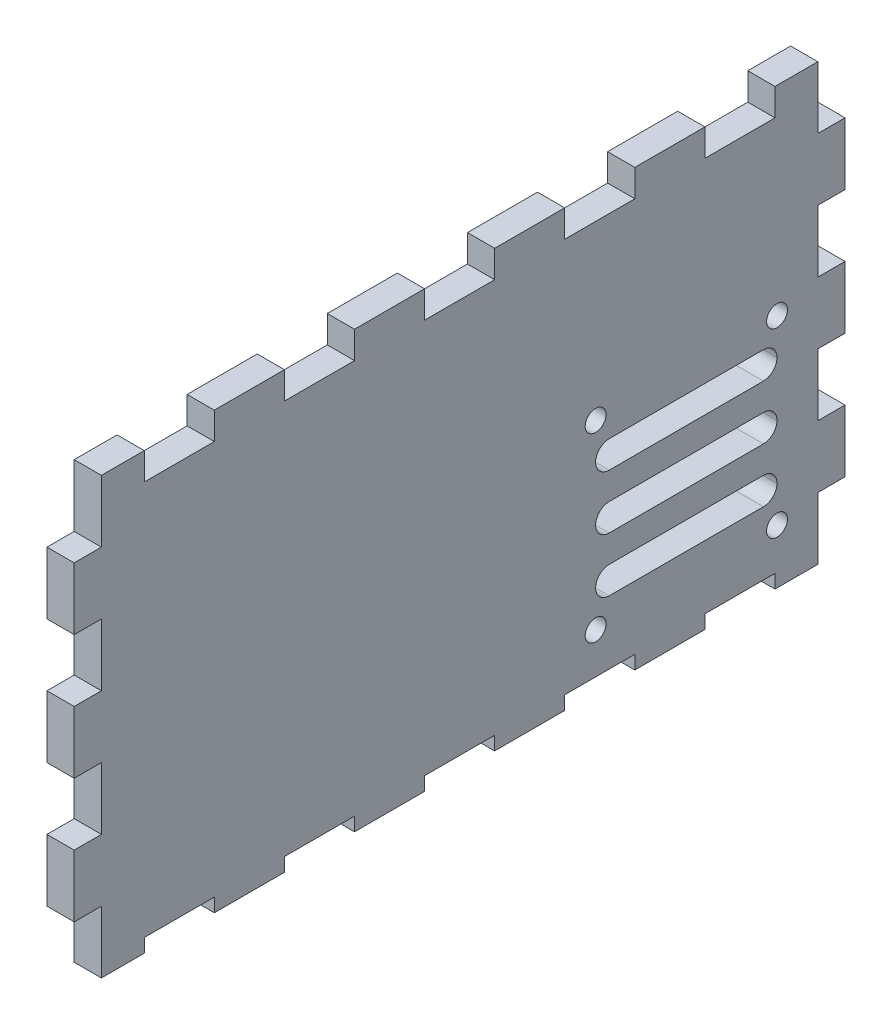
from build123d import *

# Parameters (mm, degrees)
ESBO_O1_W                = 170
ESBO_O1_H                = 96
RESSALTO_EXTRUS_O1_DEPTH = 6
CORTE_EXTRUS_O1_REACH    = 99.801
ESBO_O2_W                = 15.455454545
ESBO_O2_H                = 6
CORTE_EXTRUS_O2_REACH    = 99.801
ESBO_O3_W                = 6
ESBO_O3_H                = 13.714285714
CORTE_EXTRUS_O3_REACH    = 99.801
ESBO_O4_W                = 40
ESBO_O4_H                = 6
ESBO_O4_R                = 2.3
FILETE1_R                = 3


with BuildPart() as part:
    # Esboço1 → Ressalto-extrusão1 (new body)
    with BuildSketch(Plane(origin=(0, 0, 0), x_dir=(0, 0, -1), z_dir=(1, 0, 0))):
        Rectangle(ESBO_O1_W, ESBO_O1_H)
    extrude(amount=RESSALTO_EXTRUS_O1_DEPTH)

    # Esboço2 → Corte-extrusão1 (cut, up to next)
    with BuildSketch(Plane(origin=(6, 0, 0), x_dir=(0, 0, -1), z_dir=(1, 0, 0)), mode=Mode.PRIVATE) as corte_extrus_o1_sk1:
        with Locations((0.002272727, 45)):
            Rectangle(ESBO_O2_W, ESBO_O2_H)
    corte_extrus_o1_tool1 = extrude(corte_extrus_o1_sk1.sketch, amount=-CORTE_EXTRUS_O1_REACH, mode=Mode.PRIVATE) & part.part
    # Esboço2 → Corte-extrusão1 (cut, up to next)
    with BuildSketch(Plane(origin=(6, 0, 0), x_dir=(0, 0, -1), z_dir=(1, 0, 0)), mode=Mode.PRIVATE) as corte_extrus_o1_sk2:
        with Locations((-30.907727273, 45)):
            Rectangle(ESBO_O2_W, ESBO_O2_H)
    corte_extrus_o1_tool2 = extrude(corte_extrus_o1_sk2.sketch, amount=-CORTE_EXTRUS_O1_REACH, mode=Mode.PRIVATE) & part.part
    # Esboço2 → Corte-extrusão1 (cut, up to next)
    with BuildSketch(Plane(origin=(6, 0, 0), x_dir=(0, 0, -1), z_dir=(1, 0, 0)), mode=Mode.PRIVATE) as corte_extrus_o1_sk3:
        with Locations((-61.817727273, 45)):
            Rectangle(ESBO_O2_W, ESBO_O2_H)
    corte_extrus_o1_tool3 = extrude(corte_extrus_o1_sk3.sketch, amount=-CORTE_EXTRUS_O1_REACH, mode=Mode.PRIVATE) & part.part
    # Esboço2 → Corte-extrusão1 (cut, up to next)
    with BuildSketch(Plane(origin=(6, 0, 0), x_dir=(0, 0, -1), z_dir=(1, 0, 0)), mode=Mode.PRIVATE) as corte_extrus_o1_sk4:
        with Locations((30.912272728, 45)):
            Rectangle(ESBO_O2_W, ESBO_O2_H)
    corte_extrus_o1_tool4 = extrude(corte_extrus_o1_sk4.sketch, amount=-CORTE_EXTRUS_O1_REACH, mode=Mode.PRIVATE) & part.part
    # Esboço2 → Corte-extrusão1 (cut, up to next)
    with BuildSketch(Plane(origin=(6, 0, 0), x_dir=(0, 0, -1), z_dir=(1, 0, 0)), mode=Mode.PRIVATE) as corte_extrus_o1_sk5:
        with Locations((61.822272728, 45)):
            Rectangle(ESBO_O2_W, ESBO_O2_H)
    corte_extrus_o1_tool5 = extrude(corte_extrus_o1_sk5.sketch, amount=-CORTE_EXTRUS_O1_REACH, mode=Mode.PRIVATE) & part.part
    # Esboço2 → Corte-extrusão1 (cut, up to next)
    with BuildSketch(Plane(origin=(6, 0, 0), x_dir=(0, 0, -1), z_dir=(1, 0, 0)), mode=Mode.PRIVATE) as corte_extrus_o1_sk6:
        with Locations((-61.817727273, -48)):
            Rectangle(ESBO_O2_W, ESBO_O2_H)
    corte_extrus_o1_tool6 = extrude(corte_extrus_o1_sk6.sketch, amount=-CORTE_EXTRUS_O1_REACH, mode=Mode.PRIVATE) & part.part
    # Esboço2 → Corte-extrusão1 (cut, up to next)
    with BuildSketch(Plane(origin=(6, 0, 0), x_dir=(0, 0, -1), z_dir=(1, 0, 0)), mode=Mode.PRIVATE) as corte_extrus_o1_sk7:
        with Locations((-30.907727273, -48)):
            Rectangle(ESBO_O2_W, ESBO_O2_H)
    corte_extrus_o1_tool7 = extrude(corte_extrus_o1_sk7.sketch, amount=-CORTE_EXTRUS_O1_REACH, mode=Mode.PRIVATE) & part.part
    # Esboço2 → Corte-extrusão1 (cut, up to next)
    with BuildSketch(Plane(origin=(6, 0, 0), x_dir=(0, 0, -1), z_dir=(1, 0, 0)), mode=Mode.PRIVATE) as corte_extrus_o1_sk8:
        with Locations((0.002272727, -48)):
            Rectangle(ESBO_O2_W, ESBO_O2_H)
    corte_extrus_o1_tool8 = extrude(corte_extrus_o1_sk8.sketch, amount=-CORTE_EXTRUS_O1_REACH, mode=Mode.PRIVATE) & part.part
    # Esboço2 → Corte-extrusão1 (cut, up to next)
    with BuildSketch(Plane(origin=(6, 0, 0), x_dir=(0, 0, -1), z_dir=(1, 0, 0)), mode=Mode.PRIVATE) as corte_extrus_o1_sk9:
        with Locations((30.912272728, -48)):
            Rectangle(ESBO_O2_W, ESBO_O2_H)
    corte_extrus_o1_tool9 = extrude(corte_extrus_o1_sk9.sketch, amount=-CORTE_EXTRUS_O1_REACH, mode=Mode.PRIVATE) & part.part
    # Esboço2 → Corte-extrusão1 (cut, up to next)
    with BuildSketch(Plane(origin=(6, 0, 0), x_dir=(0, 0, -1), z_dir=(1, 0, 0)), mode=Mode.PRIVATE) as corte_extrus_o1_sk10:
        with Locations((61.822272728, -48)):
            Rectangle(ESBO_O2_W, ESBO_O2_H)
    corte_extrus_o1_tool10 = extrude(corte_extrus_o1_sk10.sketch, amount=-CORTE_EXTRUS_O1_REACH, mode=Mode.PRIVATE) & part.part
    add(corte_extrus_o1_tool1.solids().sort_by_distance((6, 45, -0.002273))[0], mode=Mode.SUBTRACT)
    add(corte_extrus_o1_tool2.solids().sort_by_distance((6, 45, 30.907727))[0], mode=Mode.SUBTRACT)
    add(corte_extrus_o1_tool3.solids().sort_by_distance((6, 45, 61.817727))[0], mode=Mode.SUBTRACT)
    add(corte_extrus_o1_tool4.solids().sort_by_distance((6, 45, -30.912273))[0], mode=Mode.SUBTRACT)
    add(corte_extrus_o1_tool5.solids().sort_by_distance((6, 45, -61.822273))[0], mode=Mode.SUBTRACT)
    add(corte_extrus_o1_tool6.solids().sort_by_distance((6, -48, 61.817727))[0], mode=Mode.SUBTRACT)
    add(corte_extrus_o1_tool7.solids().sort_by_distance((6, -48, 30.907727))[0], mode=Mode.SUBTRACT)
    add(corte_extrus_o1_tool8.solids().sort_by_distance((6, -48, -0.002273))[0], mode=Mode.SUBTRACT)
    add(corte_extrus_o1_tool9.solids().sort_by_distance((6, -48, -30.912273))[0], mode=Mode.SUBTRACT)
    add(corte_extrus_o1_tool10.solids().sort_by_distance((6, -48, -61.822273))[0], mode=Mode.SUBTRACT)

    # Esboço3 → Corte-extrusão2 (cut, up to next)
    with BuildSketch(Plane(origin=(6, 0, 0), x_dir=(0, 0, -1), z_dir=(1, 0, 0)), mode=Mode.PRIVATE) as corte_extrus_o2_sk1:
        with Locations((82, -41.142857143)):
            Rectangle(ESBO_O3_W, ESBO_O3_H)
    corte_extrus_o2_tool1 = extrude(corte_extrus_o2_sk1.sketch, amount=-CORTE_EXTRUS_O2_REACH, mode=Mode.PRIVATE) & part.part
    # Esboço3 → Corte-extrusão2 (cut, up to next)
    with BuildSketch(Plane(origin=(6, 0, 0), x_dir=(0, 0, -1), z_dir=(1, 0, 0)), mode=Mode.PRIVATE) as corte_extrus_o2_sk2:
        with Locations((-82, -41.142857143)):
            Rectangle(ESBO_O3_W, ESBO_O3_H)
    corte_extrus_o2_tool2 = extrude(corte_extrus_o2_sk2.sketch, amount=-CORTE_EXTRUS_O2_REACH, mode=Mode.PRIVATE) & part.part
    # Esboço3 → Corte-extrusão2 (cut, up to next)
    with BuildSketch(Plane(origin=(6, 0, 0), x_dir=(0, 0, -1), z_dir=(1, 0, 0)), mode=Mode.PRIVATE) as corte_extrus_o2_sk3:
        with Locations((82, -13.712857143)):
            Rectangle(ESBO_O3_W, ESBO_O3_H)
    corte_extrus_o2_tool3 = extrude(corte_extrus_o2_sk3.sketch, amount=-CORTE_EXTRUS_O2_REACH, mode=Mode.PRIVATE) & part.part
    # Esboço3 → Corte-extrusão2 (cut, up to next)
    with BuildSketch(Plane(origin=(6, 0, 0), x_dir=(0, 0, -1), z_dir=(1, 0, 0)), mode=Mode.PRIVATE) as corte_extrus_o2_sk4:
        with Locations((82, 13.717142857)):
            Rectangle(ESBO_O3_W, ESBO_O3_H)
    corte_extrus_o2_tool4 = extrude(corte_extrus_o2_sk4.sketch, amount=-CORTE_EXTRUS_O2_REACH, mode=Mode.PRIVATE) & part.part
    # Esboço3 → Corte-extrusão2 (cut, up to next)
    with BuildSketch(Plane(origin=(6, 0, 0), x_dir=(0, 0, -1), z_dir=(1, 0, 0)), mode=Mode.PRIVATE) as corte_extrus_o2_sk5:
        with Locations((82, 41.147142857)):
            Rectangle(ESBO_O3_W, ESBO_O3_H)
    corte_extrus_o2_tool5 = extrude(corte_extrus_o2_sk5.sketch, amount=-CORTE_EXTRUS_O2_REACH, mode=Mode.PRIVATE) & part.part
    # Esboço3 → Corte-extrusão2 (cut, up to next)
    with BuildSketch(Plane(origin=(6, 0, 0), x_dir=(0, 0, -1), z_dir=(1, 0, 0)), mode=Mode.PRIVATE) as corte_extrus_o2_sk6:
        with Locations((-82, -13.712857143)):
            Rectangle(ESBO_O3_W, ESBO_O3_H)
    corte_extrus_o2_tool6 = extrude(corte_extrus_o2_sk6.sketch, amount=-CORTE_EXTRUS_O2_REACH, mode=Mode.PRIVATE) & part.part
    # Esboço3 → Corte-extrusão2 (cut, up to next)
    with BuildSketch(Plane(origin=(6, 0, 0), x_dir=(0, 0, -1), z_dir=(1, 0, 0)), mode=Mode.PRIVATE) as corte_extrus_o2_sk7:
        with Locations((-82, 13.717142857)):
            Rectangle(ESBO_O3_W, ESBO_O3_H)
    corte_extrus_o2_tool7 = extrude(corte_extrus_o2_sk7.sketch, amount=-CORTE_EXTRUS_O2_REACH, mode=Mode.PRIVATE) & part.part
    # Esboço3 → Corte-extrusão2 (cut, up to next)
    with BuildSketch(Plane(origin=(6, 0, 0), x_dir=(0, 0, -1), z_dir=(1, 0, 0)), mode=Mode.PRIVATE) as corte_extrus_o2_sk8:
        with Locations((-82, 41.147142857)):
            Rectangle(ESBO_O3_W, ESBO_O3_H)
    corte_extrus_o2_tool8 = extrude(corte_extrus_o2_sk8.sketch, amount=-CORTE_EXTRUS_O2_REACH, mode=Mode.PRIVATE) & part.part
    add(corte_extrus_o2_tool1.solids().sort_by_distance((6, -41.142857, -82))[0], mode=Mode.SUBTRACT)
    add(corte_extrus_o2_tool2.solids().sort_by_distance((6, -41.142857, 82))[0], mode=Mode.SUBTRACT)
    add(corte_extrus_o2_tool3.solids().sort_by_distance((6, -13.712857, -82))[0], mode=Mode.SUBTRACT)
    add(corte_extrus_o2_tool4.solids().sort_by_distance((6, 13.717143, -82))[0], mode=Mode.SUBTRACT)
    add(corte_extrus_o2_tool5.solids().sort_by_distance((6, 41.147143, -82))[0], mode=Mode.SUBTRACT)
    add(corte_extrus_o2_tool6.solids().sort_by_distance((6, -13.712857, 82))[0], mode=Mode.SUBTRACT)
    add(corte_extrus_o2_tool7.solids().sort_by_distance((6, 13.717143, 82))[0], mode=Mode.SUBTRACT)
    add(corte_extrus_o2_tool8.solids().sort_by_distance((6, 41.147143, 82))[0], mode=Mode.SUBTRACT)

    # Esboço4 → Corte-extrusão3 (cut, up to next)
    with BuildSketch(Plane(origin=(6, 0, 0), x_dir=(0, 0, -1), z_dir=(1, 0, 0)), mode=Mode.PRIVATE) as corte_extrus_o3_sk1:
        with Locations((50, -4)):
            Rectangle(ESBO_O4_W, ESBO_O4_H)
    corte_extrus_o3_tool1 = extrude(corte_extrus_o3_sk1.sketch, amount=-CORTE_EXTRUS_O3_REACH, mode=Mode.PRIVATE) & part.part
    # Esboço4 → Corte-extrusão3 (cut, up to next)
    with BuildSketch(Plane(origin=(6, 0, 0), x_dir=(0, 0, -1), z_dir=(1, 0, 0)), mode=Mode.PRIVATE) as corte_extrus_o3_sk2:
        with Locations((50, -16)):
            Rectangle(ESBO_O4_W, ESBO_O4_H)
    corte_extrus_o3_tool2 = extrude(corte_extrus_o3_sk2.sketch, amount=-CORTE_EXTRUS_O3_REACH, mode=Mode.PRIVATE) & part.part
    # Esboço4 → Corte-extrusão3 (cut, up to next)
    with BuildSketch(Plane(origin=(6, 0, 0), x_dir=(0, 0, -1), z_dir=(1, 0, 0)), mode=Mode.PRIVATE) as corte_extrus_o3_sk3:
        with Locations((50, -28)):
            Rectangle(ESBO_O4_W, ESBO_O4_H)
    corte_extrus_o3_tool3 = extrude(corte_extrus_o3_sk3.sketch, amount=-CORTE_EXTRUS_O3_REACH, mode=Mode.PRIVATE) & part.part
    # Esboço4 → Corte-extrusão3 (cut, up to next)
    with BuildSketch(Plane(origin=(6, 0, 0), x_dir=(0, 0, -1), z_dir=(1, 0, 0)), mode=Mode.PRIVATE) as corte_extrus_o3_sk4:
        with Locations((30, -36)):
            Circle(ESBO_O4_R)
    corte_extrus_o3_tool4 = extrude(corte_extrus_o3_sk4.sketch, amount=-CORTE_EXTRUS_O3_REACH, mode=Mode.PRIVATE) & part.part
    # Esboço4 → Corte-extrusão3 (cut, up to next)
    with BuildSketch(Plane(origin=(6, 0, 0), x_dir=(0, 0, -1), z_dir=(1, 0, 0)), mode=Mode.PRIVATE) as corte_extrus_o3_sk5:
        with Locations((70, -36)):
            Circle(ESBO_O4_R)
    corte_extrus_o3_tool5 = extrude(corte_extrus_o3_sk5.sketch, amount=-CORTE_EXTRUS_O3_REACH, mode=Mode.PRIVATE) & part.part
    # Esboço4 → Corte-extrusão3 (cut, up to next)
    with BuildSketch(Plane(origin=(6, 0, 0), x_dir=(0, 0, -1), z_dir=(1, 0, 0)), mode=Mode.PRIVATE) as corte_extrus_o3_sk6:
        with Locations((70, 4)):
            Circle(ESBO_O4_R)
    corte_extrus_o3_tool6 = extrude(corte_extrus_o3_sk6.sketch, amount=-CORTE_EXTRUS_O3_REACH, mode=Mode.PRIVATE) & part.part
    # Esboço4 → Corte-extrusão3 (cut, up to next)
    with BuildSketch(Plane(origin=(6, 0, 0), x_dir=(0, 0, -1), z_dir=(1, 0, 0)), mode=Mode.PRIVATE) as corte_extrus_o3_sk7:
        with Locations((30, 4)):
            Circle(ESBO_O4_R)
    corte_extrus_o3_tool7 = extrude(corte_extrus_o3_sk7.sketch, amount=-CORTE_EXTRUS_O3_REACH, mode=Mode.PRIVATE) & part.part
    add(corte_extrus_o3_tool1.solids().sort_by_distance((6, -4, -50))[0], mode=Mode.SUBTRACT)
    add(corte_extrus_o3_tool2.solids().sort_by_distance((6, -16, -50))[0], mode=Mode.SUBTRACT)
    add(corte_extrus_o3_tool3.solids().sort_by_distance((6, -28, -50))[0], mode=Mode.SUBTRACT)
    add(corte_extrus_o3_tool4.solids().sort_by_distance((6, -36, -30))[0], mode=Mode.SUBTRACT)
    add(corte_extrus_o3_tool5.solids().sort_by_distance((6, -36, -70))[0], mode=Mode.SUBTRACT)
    add(corte_extrus_o3_tool6.solids().sort_by_distance((6, 4, -70))[0], mode=Mode.SUBTRACT)
    add(corte_extrus_o3_tool7.solids().sort_by_distance((6, 4, -30))[0], mode=Mode.SUBTRACT)

    # Filete1
    filete1_edges = [part.edges().sort_by_distance(p)[0] for p in [
        (3, -13, -70),
        (3, -25, -70),
        (3, -13, -30),
        (3, -25, -30),
        (3, -19, -70),
        (3, -31, -70),
        (3, -31, -30),
        (3, -19, -30),
        (3, -1, -70),
        (3, -7, -70),
        (3, -7, -30),
        (3, -1, -30),
    ]]
    fillet(filete1_edges, radius=FILETE1_R - 0.0001)  # a hair under: the kernel refuses the full size


solid = part.part
